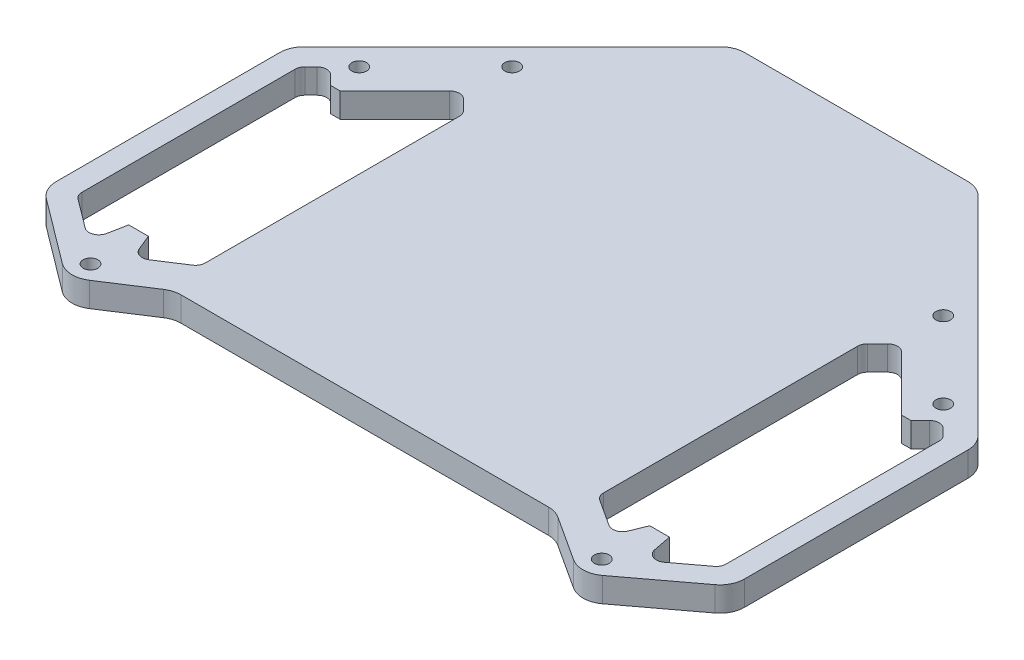
from build123d import *

# Parameters (mm, degrees)
SKETCH1_R            = 1.5
BOSS_EXTRUDE1_DEPTH  = 5
FILLET1_R            = 2
FILLET1_OF_MIRROR1_R = 2
SKETCH2_W            = 70
SKETCH2_H            = 97
CUT_EXTRUDE1_DEPTH   = 2.5
FILLET2_R            = 5


with BuildPart() as part:
    # Sketch1 → Boss-Extrude1 (new body)
    with BuildSketch(Plane(origin=(0, 0, 0), x_dir=(1, 0, 0), z_dir=(0, 1, 0))):
        Polygon((-52.164149312, -38.645247828), (-70, -25.247940817), (-70, 24.752308679), (-24.752308679, 70), (0, 70), (0, -30), (-38.851635079, -30), align=None)
        with Locations((-43.840620434, 43.840620434)):
            Circle(SKETCH1_R, mode=Mode.SUBTRACT)
        with Locations((-51.997575213, -33.767620171)):
            Circle(SKETCH1_R, mode=Mode.SUBTRACT)
        with Locations((-59.39696962, 28.284271247)):
            Circle(SKETCH1_R, mode=Mode.SUBTRACT)
        Polygon((-59.003765723, 22.1), (-57.095959493, 22.1), (-44.547727215, 34.648232278), (-40.5, 30.600505063), (-40.5, -23), (-48.796166422, -28.387593469), (-51, -23), (-55, -23), (-56.33662338, -29.883022962), (-65.5, -23), (-65.5, 22.181240867), (-62.292503295, 25.388737572), align=None, mode=Mode.SUBTRACT)
    boss_extrude1 = extrude(amount=BOSS_EXTRUDE1_DEPTH)

    # Fillet1
    fillet1_edges = [part.edges().sort_by_distance(p)[0] for p in [
        (-40.5, 2.5, 23),
        (-48.796166422, 2.5, 28.387593469),
        (-56.33662338, 2.5, 29.883022962),
        (-65.5, 2.5, 23),
        (-65.5, 2.5, -22.181240867),
        (-62.292503295, 2.5, -25.388737572),
        (-40.5, 2.5, -30.600505063),
        (-44.547727215, 2.5, -34.648232278),
    ]]
    fillet(fillet1_edges, radius=FILLET1_R)

    # Mirror1: Boss-Extrude1 across plane
    add(boss_extrude1.mirror(Plane(origin=(0, 5, 30), x_dir=(0, 0, 1), z_dir=(-1, 0, 0))))

    # Fillet1 of Mirror1
    fillet1_of_mirror1_edges = [part.edges().sort_by_distance(p)[0] for p in [
        (40.5, 2.5, 23),
        (48.796166422, 2.5, 28.387593469),
        (56.33662338, 2.5, 29.883022962),
        (65.5, 2.5, 23),
        (65.5, 2.5, -22.181240867),
        (62.292503295, 2.5, -25.388737572),
        (40.5, 2.5, -30.600505063),
        (44.547727215, 2.5, -34.648232278),
    ]]
    fillet(fillet1_of_mirror1_edges, radius=FILLET1_OF_MIRROR1_R)

    # Sketch2 → Cut-Extrude1 (cut)
    with BuildSketch(Plane(origin=(0, 0, 0), x_dir=(1, 0, 0), z_dir=(0, 1, 0))):
        with Locations((0, 21.5)):
            Rectangle(SKETCH2_W, SKETCH2_H)
    extrude(amount=CUT_EXTRUDE1_DEPTH, mode=Mode.SUBTRACT)

    # Fillet2
    fillet2_edges = [part.edges().sort_by_distance(p)[0] for p in [
        (-70, 2.5, 25.247940817),
        (-70, 2.5, -24.752308679),
        (-24.752308679, 3.75, -70),
        (24.752308679, 3.75, -70),
        (70, 2.5, -24.752308679),
        (70, 2.5, 25.247940817),
        (38.851635079, 2.5, 30),
        (52.164149312, 2.5, 38.645247828),
        (-38.851635079, 2.5, 30),
        (-52.164149312, 2.5, 38.645247828),
    ]]
    fillet(fillet2_edges, radius=FILLET2_R)


solid = part.part
